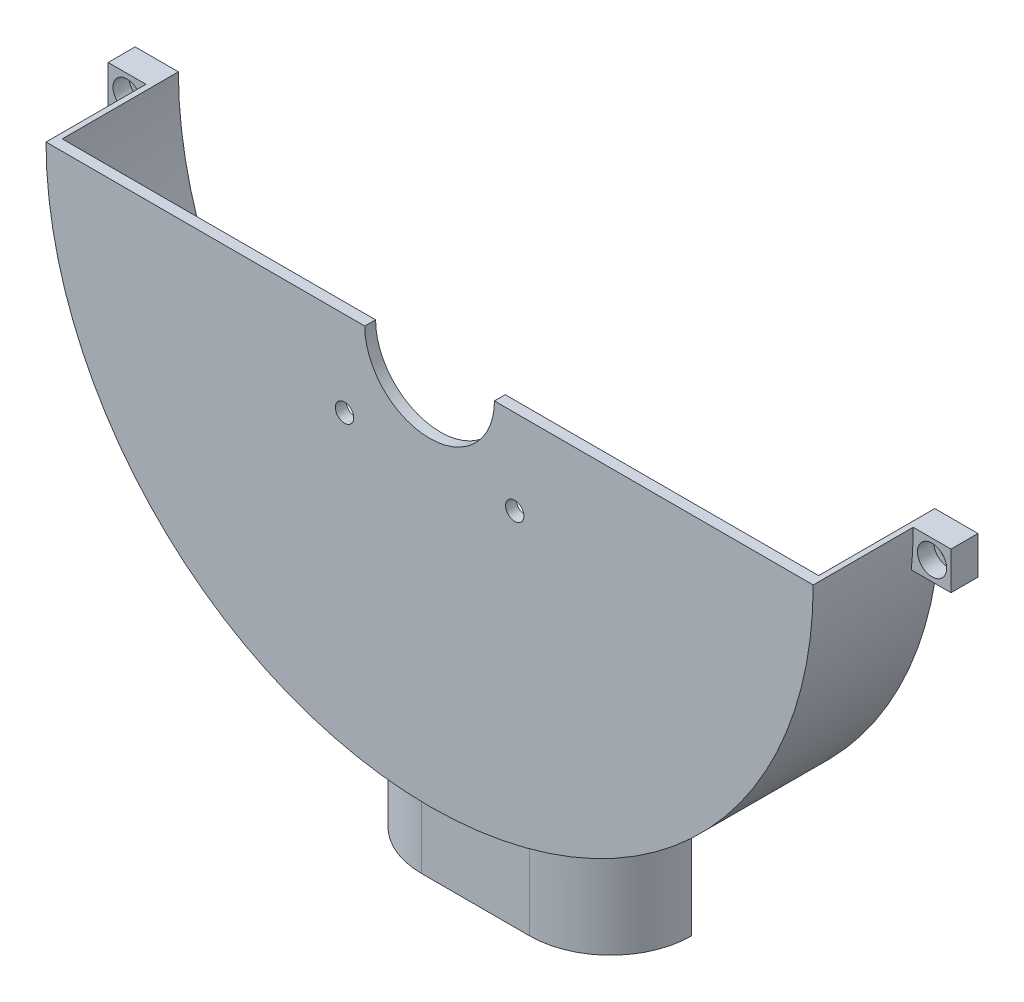
from build123d import *

# Parameters (mm, degrees)
BOSS_EXTRUDE1_DEPTH = 21.5
BOSS_EXTRUDE2_DEPTH = 2
SKETCH3_W           = 50
SKETCH3_H           = 20
BOSS_EXTRUDE3_DEPTH = 15
SKETCH8_R           = 1.6
BOSS_EXTRUDE5_DEPTH = 5
SKETCH10_R          = 2.7
SKETCH10_R_2        = 2.6
CUT_EXTRUDE5_DEPTH  = 3
FILLET2_R           = 15
SKETCH11_W          = 43.237900078
SKETCH11_H          = 3
CUT_EXTRUDE7_DEPTH  = 20
SKETCH13_R          = 1.7
CUT_EXTRUDE8_DEPTH  = 10
SKETCH14_R          = 12
CUT_EXTRUDE9_DEPTH  = 10


with BuildPart() as part:
    # Sketch1 → Boss-Extrude1 (new body)
    with BuildSketch(Plane.XY):
        with BuildLine():
            Line((71, 0), (70, 0))
            ThreePointArc((70, 0), (0, -70), (-70, 0))
            Line((-70, 0), (-71, 0))
            ThreePointArc((-71, 0), (0, -71), (71, 0))
        make_face()
    extrude(amount=BOSS_EXTRUDE1_DEPTH)

    # Sketch2 → Boss-Extrude2 (add)
    with BuildSketch(Plane.XY.offset(21.5)):
        with BuildLine():
            Line((71, 0), (70, 0))
            ThreePointArc((70, 0), (0, -70), (-70, 0))
            Line((-70, 0), (-71, 0))
            ThreePointArc((-71, 0), (0, -71), (71, 0))
        make_face()
        with BuildLine():
            Line((-21.5, 0), (-70, 0))
            ThreePointArc((-70, 0), (0, -70), (70, 0))
            Line((70, 0), (21.5, 0))
            Line((21.5, 0), (-21.5, 0))
        make_face()
    extrude(amount=BOSS_EXTRUDE2_DEPTH)

    # Sketch3 → Boss-Extrude3 (add)
    with BuildSketch(Plane(origin=(0, 0, 0), x_dir=(-1, 0, 0), z_dir=(0, 0, -1))):
        with BuildLine():
            Line((-25, -66.452990903), (-25, -71))
            Line((-25, -71), (0, -71))
            ThreePointArc((0, -71), (-12.705070757, -69.853999006), (-25, -66.452990903))
        make_face()
        with BuildLine():
            ThreePointArc((25, -66.452990903), (12.705070757, -69.853999006), (0, -71))
            Line((0, -71), (25, -71))
            Line((25, -71), (25, -66.452990903))
        make_face()
        with Locations((0, -81)):
            Rectangle(SKETCH3_W, SKETCH3_H)
    extrude(amount=-BOSS_EXTRUDE3_DEPTH)

    # Sketch8 → Boss-Extrude5 (add)
    # profile 1 of 2: a face of its own
    with BuildSketch(Plane(origin=(0, 0, 0), x_dir=(-1, 0, 0), z_dir=(0, 0, -1))):
        with BuildLine():
            ThreePointArc((-70.654086931, -7), (-70.913469003, -3.504270818), (-71, 0))
            Line((-71, 0), (-78, 0))
            Line((-78, 0), (-78, -7))
            Line((-78, -7), (-70.654086931, -7))
        make_face()
        with Locations((-74.5, -3.5)):
            Circle(SKETCH8_R, mode=Mode.SUBTRACT)
    # profile 2 of 2: a face of its own
    with BuildSketch(Plane(origin=(0, 0, 0), x_dir=(-1, 0, 0), z_dir=(0, 0, -1))):
        with BuildLine():
            Line((78, 0), (71, 0))
            ThreePointArc((71, 0), (70.913469003, -3.504270818), (70.654086931, -7))
            Line((70.654086931, -7), (78, -7))
            Line((78, -7), (78, 0))
        make_face()
        with Locations(Location((74.5, -3.5, 0), (0, 0, 180))):
            Circle(SKETCH8_R, mode=Mode.SUBTRACT)
    extrude(amount=-BOSS_EXTRUDE5_DEPTH)

    # Sketch10 → Cut-Extrude5 (cut)
    with BuildSketch(Plane.XY.offset(5)):
        with Locations((74.5, -3.5)):
            Circle(SKETCH10_R)
        with Locations((-74.5, -3.5)):
            Circle(SKETCH10_R_2)
    extrude(amount=-CUT_EXTRUDE5_DEPTH, mode=Mode.SUBTRACT)

    # Fillet2
    fillet2_edges = [part.edges().sort_by_distance(p)[0] for p in [
        (-25, -78.726495452, 15),
        (25, -78.726495452, 15),
    ]]
    fillet(fillet2_edges, radius=FILLET2_R - 0.0001)  # a hair under: the kernel refuses the full size

    # Sketch11 → Cut-Extrude7 (cut)
    with BuildSketch(Plane.XZ.offset(91)):
        with Locations((0, 1.5)):
            Rectangle(SKETCH11_W, SKETCH11_H)
        with BuildLine():
            Line((-21.618950039, 3), (21.618950039, 3))
            ThreePointArc((21.618950039, 3), (17.348469228, 9.486832981), (10, 12))
            Line((10, 12), (-10, 12))
            ThreePointArc((-10, 12), (-17.348469228, 9.486832981), (-21.618950039, 3))
        make_face()
    extrude(amount=-CUT_EXTRUDE7_DEPTH, mode=Mode.SUBTRACT)

    # Sketch13 → Cut-Extrude8 (cut)
    with BuildSketch(Plane.XY.offset(23.5)):
        with Locations((-15.75, -15.75)):
            Circle(SKETCH13_R)
        with Locations((15.75, -15.75)):
            Circle(SKETCH13_R)
    extrude(amount=-CUT_EXTRUDE8_DEPTH, mode=Mode.SUBTRACT)

    # Sketch14 → Cut-Extrude9 (cut)
    with BuildSketch(Plane.XY.offset(23.5)):
        Circle(SKETCH14_R)
    extrude(amount=-CUT_EXTRUDE9_DEPTH, mode=Mode.SUBTRACT)


solid = part.part
